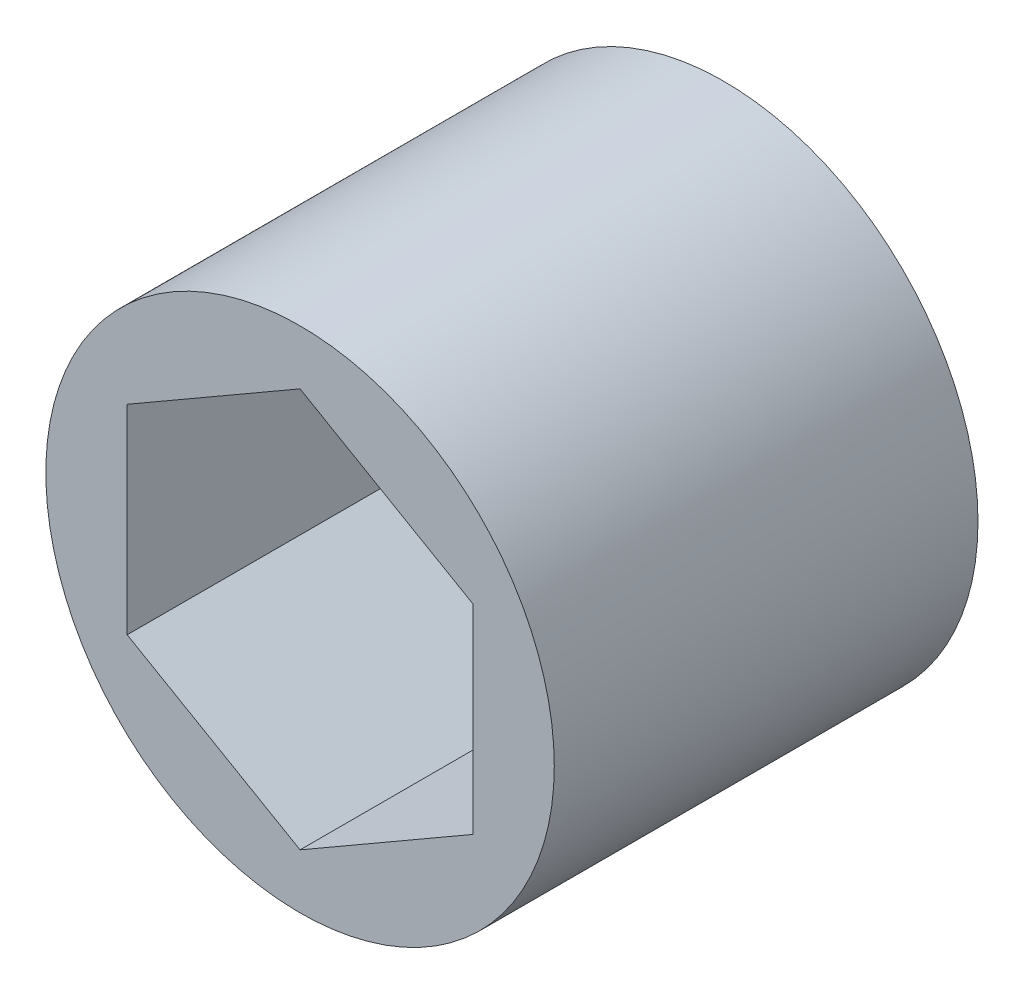
from build123d import *

# Parameters (mm, degrees)
SKETCH1_R           = 9.525
BOSS_EXTRUDE1_DEPTH = 7.9375


with BuildPart() as part:
    # Sketch1 → Boss-Extrude1 (new, symmetric)
    with BuildSketch(Plane.XY):
        Circle(SKETCH1_R)
        Polygon((0, 7.478995387), (-6.477, 3.739497694), (-6.477, -3.739497694), (0, -7.478995387), (6.477, -3.739497694), (6.477, 3.739497694), align=None, mode=Mode.SUBTRACT)
    extrude(amount=BOSS_EXTRUDE1_DEPTH, both=True)


solid = part.part
